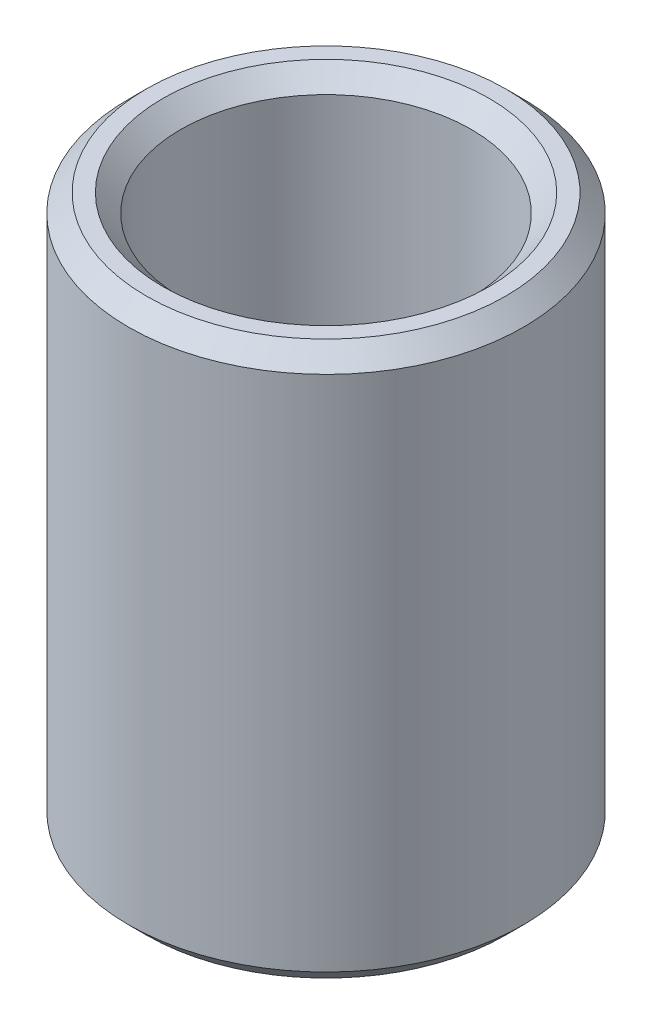
from build123d import *

# Parameters (mm, degrees)
SKETCH1_R           = 42.5
BOSS_EXTRUDE1_DEPTH = 119.096016081
SKETCH2_R           = 31.251455777
CUT_EXTRUDE1_DEPTH  = 134.403002389
CHAMFER1_SIZE       = 3.853268379


with BuildPart() as part:
    # Sketch1 → Boss-Extrude1 (new body)
    with BuildSketch(Plane(origin=(0, 0, 0), x_dir=(1, 0, 0), z_dir=(0, 1, 0))):
        Circle(SKETCH1_R)
    extrude(amount=BOSS_EXTRUDE1_DEPTH)

    # Sketch2 → Cut-Extrude1 (cut, through all)
    with BuildSketch(Plane(origin=(0, 0, 0), x_dir=(1, 0, 0), z_dir=(0, 1, 0))):
        Circle(SKETCH2_R)
    extrude(amount=CUT_EXTRUDE1_DEPTH, mode=Mode.SUBTRACT)

    # Chamfer1
    chamfer1_edges = [part.edges().sort_by_distance(p)[0] for p in [
        (-31.251455777, 119.096016081, 0),
        (-31.251455777, 0, 0),
        (-42.5, 0, 0),
        (-42.5, 119.096016081, 0),
    ]]
    chamfer(chamfer1_edges, length=CHAMFER1_SIZE)


solid = part.part
